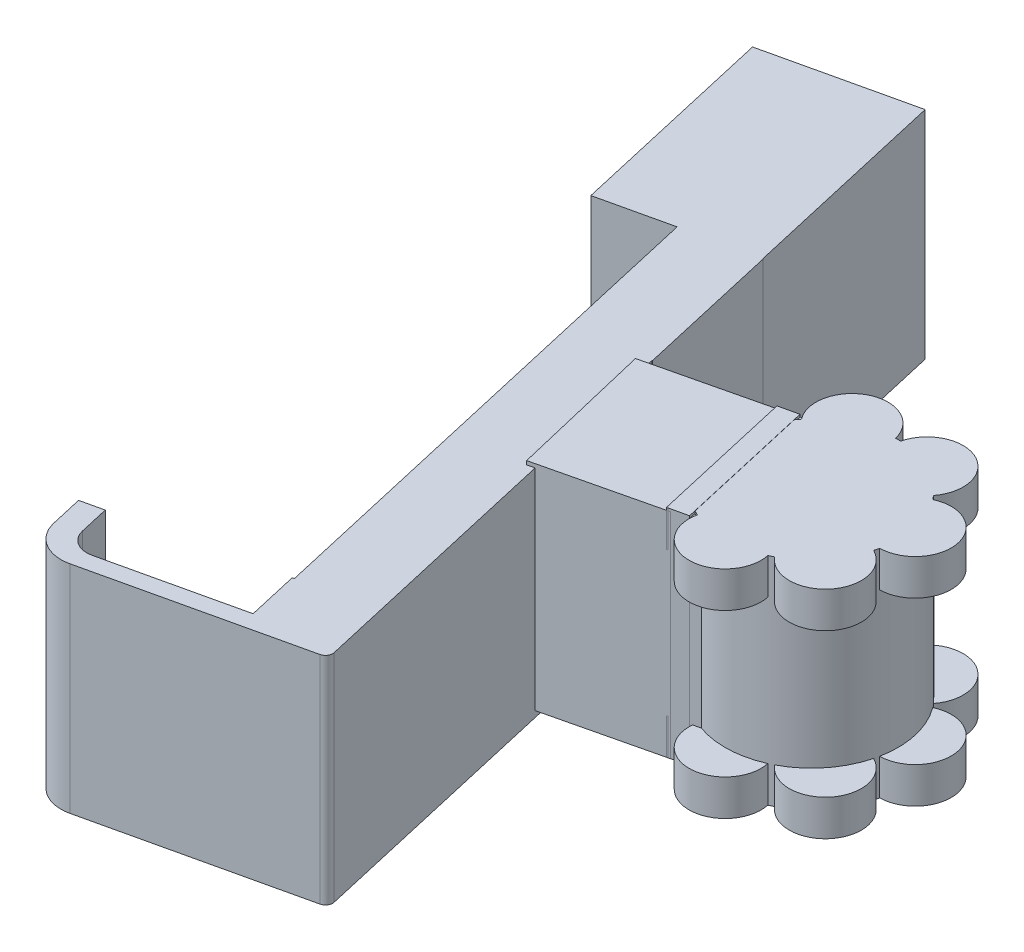
from build123d import *

# Parameters (mm, degrees)
SKETCH2_R                 = 30.48
BOSS_EXTRUDE1_DEPTH       = 76.2
SKETCH3_R                 = 12.7
BOSS_EXTRUDE2_DEPTH       = 12.7
BOSS_EXTRUDE6_START       = -12.7
SKETCH6_R                 = 12.7
BOSS_EXTRUDE6_DEPTH       = 12.7
SKETCH9_W                 = 51.728443154
SKETCH9_H                 = 76.282804762
BOSS_EXTRUDE7_DEPTH       = 48.26
BOSS_EXTRUDE8_DEPTH       = 76.2
BOSS_EXTRUDE8_DEPTH_BACK  = 203.2
SKETCH10_W                = 76.2
SKETCH10_H                = 25.4
FILLET1_R                 = 2.54
SKETCH11_W                = 24.315389243
SKETCH11_H                = 76.2
BOSS_EXTRUDE9_DEPTH       = 63.5
FILLET2_R                 = 12.7
SKETCH14_W                = 55.001607209
SKETCH14_H                = 80.712972361
CUT_EXTRUDE4_DEPTH        = 20.828
FILLET3_R                 = 7.62
SKETCH15_W                = 75.756816186
SKETCH15_H                = 76.2
BOSS_EXTRUDE10_DEPTH      = 25.4
SKETCH17_W                = 67.504794481
SKETCH17_H                = 69.753361914
CUT_EXTRUDE5_DEPTH        = 38.1
SKETCH18_R                = 2.54
CUT_EXTRUDE6_DEPTH        = 164.084
LPATTERN1_COUNT           = 2
LPATTERN1_PITCH           = 66.04
BOSS_EXTRUDE11_DEPTH      = 24.13
BOSS_EXTRUDE11_DEPTH_BACK = 24.13
SKETCH29_W                = 10.319134409
SKETCH29_H                = 15.64174453
CUT_EXTRUDE7_DEPTH        = 29.718
BOSS_EXTRUDE13_DEPTH      = 38.1
SKETCH32_W                = 39.507014282
SKETCH32_H                = 29.782993716
CUT_EXTRUDE8_DEPTH        = 17.78
SKETCH33_W                = 41.356450413
SKETCH33_H                = 75.385657755
CUT_EXTRUDE10_DEPTH       = 102.362
BODY_MOVE_COPY1_DEPTH     = 0.082804762
BODY_MOVE_COPY1_START     = 63.5
BODY_MOVE_COPY1_2_DEPTH   = 0.082804762
BODY_MOVE_COPY1_START_2   = 76.2
BODY_MOVE_COPY1_3_DEPTH   = 0.082804762
BODY_MOVE_COPY1_START_3   = 12.7
BODY_MOVE_COPY1_4_DEPTH   = 0.082804762
BODY_MOVE_COPY1_START_4   = 76.282804762
BODY_MOVE_COPY1_5_DEPTH   = 0.082804762
BOSS_EXTRUDE14_DEPTH      = 15.24
BOSS_EXTRUDE14_DEPTH_BACK = 41.402
SKETCH34_W                = 51.737242341
SKETCH34_H                = 75.399576407
SCALE1_SCALE              = 2
SCALE2_SCALE              = 1.5
SCALE3_SCALE              = 0.5
SCALE4_SCALE              = 2


# Read off the part's stored shape, not the designer's step: Body-Move/Copy1
with BuildPart() as part:
    # Sketch2 → Boss-Extrude1 (new body)
    with BuildSketch(Plane(origin=(0, 0, 0), x_dir=(1, 0, 0), z_dir=(0, 1, 0))):
        with Locations(Location((0, 0, 0), (0, 0, 90))):
            Circle(SKETCH2_R)
    extrude(amount=BOSS_EXTRUDE1_DEPTH)

    # Sketch3 → Boss-Extrude2 (add)
    with BuildSketch(Plane(origin=(0, 76.2, 0), x_dir=(1, 0, 0), z_dir=(0, 1, 0))):
        with Locations((0, -30.48)):
            Circle(SKETCH3_R)
        with Locations((-23.830223586, -19.003969161)):
            Circle(SKETCH3_R)
        with Locations((-29.715802763, 6.782438067)):
            Circle(SKETCH3_R)
        with Locations((-13.224776368, 27.461531094)):
            Circle(SKETCH3_R)
        with Locations((13.224776368, 27.461531094)):
            Circle(SKETCH3_R)
        with Locations((29.715802763, 6.782438067)):
            Circle(SKETCH3_R)
        with Locations((23.830223586, -19.003969161)):
            Circle(SKETCH3_R)
    extrude(amount=-BOSS_EXTRUDE2_DEPTH)

    # Sketch6 → Boss-Extrude6 (add)
    with BuildSketch(Plane(origin=(0, 0, 0), x_dir=(-1, 0, 0), z_dir=(0, -1, 0)).offset(BOSS_EXTRUDE6_START)):
        with Locations((0, -30.48)):
            Circle(SKETCH6_R)
        with Locations((-23.830223586, -19.003969161)):
            Circle(SKETCH6_R)
        with Locations((-29.715802763, 6.782438067)):
            Circle(SKETCH6_R)
        with Locations((-13.224776368, 27.461531094)):
            Circle(SKETCH6_R)
        with Locations((13.224776368, 27.461531094)):
            Circle(SKETCH6_R)
        with Locations((29.715802763, 6.782438067)):
            Circle(SKETCH6_R)
        with Locations((23.830223586, -19.003969161)):
            Circle(SKETCH6_R)
    extrude(amount=BOSS_EXTRUDE6_DEPTH)

    # Sketch9 → Boss-Extrude7 (add)
    with BuildSketch(Plane(origin=(-19.194675463, 0, 4.381059417), x_dir=(-0.22252093395629824, 0, -0.9749279121818273), z_dir=(0.9749279121818274, 0, -0.22252093395629827))):
        with Locations((0.024108474, 38.141402381)):
            Rectangle(SKETCH9_W, SKETCH9_H)
    extrude(amount=-BOSS_EXTRUDE7_DEPTH)

    # Sketch10 → Boss-Extrude8 (add, two sides: drawn at the far end of the back side and taken through both)
    with BuildSketch(Plane(origin=(-5.760695382, 0, -25.239255567), x_dir=(0, 1, 0), z_dir=(-0.22252093395629827, 0, -0.9749279121818274)).offset(-BOSS_EXTRUDE8_DEPTH_BACK)):
        with Locations((38.182804762, -80.648302307)):
            Rectangle(SKETCH10_W, SKETCH10_H)
    extrude(amount=BOSS_EXTRUDE8_DEPTH + BOSS_EXTRUDE8_DEPTH_BACK)

    # Fillet1
    fillet1_edges = [part.edges().sort_by_distance(p)[0] for p in [
        (-26.789138106, 38.182804762, 187.986015879),
    ]]
    fillet(fillet1_edges, radius=FILLET1_R)

    # Sketch11 → Boss-Extrude9 (add)
    with BuildSketch(Plane(origin=(-91.007865474, 0, 20.771951413), x_dir=(0.22252093395629827, 0, 0.9749279121818273), z_dir=(-0.9749279121818274, 0, 0.2225209339562983))):
        with Locations((165.153975328, 38.182804762)):
            Rectangle(SKETCH11_W, SKETCH11_H)
    extrude(amount=BOSS_EXTRUDE9_DEPTH)

    # Fillet2
    fillet2_edges = [part.edges().sort_by_distance(p)[0] for p in [
        (-113.460229499, 38.182804762, 207.768126907),
    ]]
    fillet(fillet2_edges, radius=FILLET2_R)

    # Sketch14 → Cut-Extrude4 (cut)
    with BuildSketch(Plane(origin=(33.479672102, 0, 146.684027623), x_dir=(-0.9749279121818273, 0, 0.22252093395629827), z_dir=(-0.2225209339562983, 0, -0.9749279121818274))):
        with Locations((121.488256365, 38.447479976)):
            Rectangle(SKETCH14_W, SKETCH14_H)
    extrude(amount=-CUT_EXTRUDE4_DEPTH, mode=Mode.SUBTRACT)

    # Fillet3
    fillet3_edges = [part.edges().sort_by_distance(p)[0] for p in [
        (-107.139255058, 38.182804762, 200.143010952),
    ]]
    fillet(fillet3_edges, radius=FILLET3_R)

    # Sketch15 → Boss-Extrude10 (add)
    with BuildSketch(Plane(origin=(-91.007865474, 0, 20.771951413), x_dir=(0.22252093395629827, 0, 0.9749279121818273), z_dir=(-0.9749279121818274, 0, 0.2225209339562983))):
        with Locations((-64.209921958, 38.182804762)):
            Rectangle(SKETCH15_W, SKETCH15_H)
    extrude(amount=BOSS_EXTRUDE10_DEPTH)

    # Sketch17 → Cut-Extrude5 (cut)
    with BuildSketch(Plane(origin=(-91.007865474, 0, 20.771951413), x_dir=(0.22252093395629827, 0, 0.9749279121818273), z_dir=(-0.9749279121818274, 0, 0.2225209339562983))):
        with Locations((-64.931434083, 36.64981302)):
            Rectangle(SKETCH17_W, SKETCH17_H)
    extrude(amount=CUT_EXTRUDE5_DEPTH, mode=Mode.SUBTRACT)

    # Sketch18 → Cut-Extrude6 (cut)
    with BuildSketch(Plane(origin=(-5.294109885, 0, -23.19501094), x_dir=(0.9749279121818273, 0, -0.2225209339562983), z_dir=(0.22252093395629832, 0, 0.9749279121818274))):
        with Locations((-93.317000231, 5.08)):
            Circle(SKETCH18_R)
    cut_extrude6 = extrude(amount=CUT_EXTRUDE6_DEPTH, mode=Mode.SUBTRACT)

    # LPattern1: Cut-Extrude6 ×2
    with Locations(*[(0, i * LPATTERN1_PITCH, 0) for i in range(1, LPATTERN1_COUNT)]):
        add(cut_extrude6, mode=Mode.SUBTRACT)

    # Sketch24 → Boss-Extrude11 (add, two sides: drawn at the far end of the back side and taken through both)
    with BuildSketch(Plane(origin=(0, 38.182804762, 0), x_dir=(1, 0, 0), z_dir=(0, 1, 0)).offset(-BOSS_EXTRUDE11_DEPTH_BACK)):
        Polygon((-91.836020311, -15.597668009), (-92.491872227, -11.144310268), (-96.669550778, -14.034535505), align=None)
        Polygon((-94.155460088, -25.04948652), (-89.321929621, -26.612619024), (-89.977781537, -22.159261283), align=None)
        Polygon((-92.898414743, -30.556962027), (-88.064884276, -32.120094532), (-88.720736192, -27.66673679), align=None)
        Polygon((-91.641369398, -36.064437535), (-86.807838931, -37.627570039), (-87.463690847, -33.174212298), align=None)
        Polygon((-90.384324053, -41.571913042), (-85.550793587, -43.135045547), (-86.206645502, -38.681687805), align=None)
        Polygon((-89.127278708, -47.07938855), (-84.293748242, -48.642521054), (-84.949600157, -44.189163313), align=None)
        Polygon((-87.870233363, -52.586864057), (-83.036702897, -54.149996561), (-83.692554812, -49.69663882), align=None)
        Polygon((-86.613188018, -58.094339565), (-81.779657552, -59.657472069), (-82.435509467, -55.204114328), align=None)
        Polygon((-85.356142674, -63.601815072), (-80.522612207, -65.164947576), (-81.178464122, -60.711589835), align=None)
        Polygon((-84.099097329, -69.109290579), (-79.265566862, -70.672423084), (-79.921418777, -66.219065342), align=None)
        Polygon((-82.842051984, -74.616766087), (-78.008521517, -76.179898591), (-78.664373432, -71.72654085), align=None)
        Polygon((-81.585006639, -80.124241594), (-76.751476172, -81.687374099), (-77.407328087, -77.234016357), align=None)
        Polygon((-80.327961294, -85.631717102), (-75.494430827, -87.194849606), (-76.150282742, -82.741491865), align=None)
        Polygon((-79.070915949, -91.139192609), (-74.237385482, -92.702325114), (-74.893237397, -88.248967372), align=None)
        Polygon((-77.813870604, -96.646668117), (-72.980340137, -98.209800621), (-73.636192052, -93.75644288), align=None)
        Polygon((-76.556825259, -102.154143624), (-71.723294792, -103.717276129), (-72.379146707, -99.263918387), align=None)
        Polygon((-75.299779914, -107.661619132), (-70.466249447, -109.224751636), (-71.122101363, -104.771393895), align=None)
        Polygon((-74.042734569, -113.169094639), (-69.209204102, -114.732227144), (-69.865056018, -110.278869402), align=None)
        Polygon((-72.785689224, -118.676570147), (-67.952158757, -120.239702651), (-68.608010673, -115.78634491), align=None)
        Polygon((-71.528643879, -124.184045654), (-66.695113412, -125.747178159), (-67.350965328, -121.293820417), align=None)
        Polygon((-70.271598534, -129.691521162), (-65.438068067, -131.254653666), (-66.093919983, -126.801295925), align=None)
        Polygon((-69.014553189, -135.198996669), (-64.181022722, -136.762129174), (-64.836874638, -132.308771432), align=None)
        Polygon((-67.757507844, -140.706472177), (-62.923977378, -142.269604681), (-63.579829293, -137.81624694), align=None)
        Polygon((-66.500462499, -146.213947684), (-61.666932033, -147.777080188), (-62.322783948, -143.323722447), align=None)
        Polygon((-65.243417154, -151.721423192), (-60.409886688, -153.284555696), (-61.065738603, -148.831197955), align=None)
        Polygon((-63.98637181, -157.228898699), (-59.152841343, -158.792031203), (-59.808693258, -154.338673462), align=None)
        Polygon((-62.729326465, -162.736374206), (-57.895795998, -164.299506711), (-58.551647913, -159.846148969), align=None)
        Polygon((-61.47228112, -168.243849714), (-56.638750653, -169.806982218), (-57.294602568, -165.353624477), align=None)
        Polygon((-60.215235775, -173.751325221), (-55.381705308, -175.314457726), (-56.037557223, -170.861099984), align=None)
    extrude(amount=BOSS_EXTRUDE11_DEPTH + BOSS_EXTRUDE11_DEPTH_BACK)

    # Sketch29 → Cut-Extrude7 (cut)
    with BuildSketch(Plane(origin=(-22.716790549, 0, -99.528762475), x_dir=(-0.9749279121818273, 0, 0.22252093395629827), z_dir=(-0.2225209339562983, 0, -0.9749279121818274))):
        with Locations((100.830084752, 61.756724735)):
            Rectangle(SKETCH29_W, SKETCH29_H)
    extrude(amount=-CUT_EXTRUDE7_DEPTH, mode=Mode.SUBTRACT)

    # Sketch30 → Boss-Extrude13 (add)
    with BuildSketch(Plane(origin=(0, 0.082804762, 0), x_dir=(-1, 0, 0), z_dir=(0, -1, 0))):
        Polygon((101.002769309, 70.397611685), (91.080663922, 25.61678931), (114.836558826, 20.353185823), (124.758664212, 65.134008198), align=None)
    extrude(amount=BOSS_EXTRUDE13_DEPTH)

    # Sketch32 → Cut-Extrude8 (cut)
    with BuildSketch(Plane(origin=(-105.164030087, 0, 23.301237763), x_dir=(0.21632398921904566, 0, 0.9763216333198595), z_dir=(-0.9763216333198595, 0, 0.21632398921904566))):
        with Locations((-67.649390267, -18.065303468)):
            Rectangle(SKETCH32_W, SKETCH32_H)
    extrude(amount=-CUT_EXTRUDE8_DEPTH, mode=Mode.SUBTRACT)

    # Sketch33 → Cut-Extrude10 (cut)
    with BuildSketch(Plane(origin=(0, 0, 0), x_dir=(0.9749279121818273, 0, -0.2225209339562983), z_dir=(0, 1, 0))):
        with Locations((-47.153059458, 2.897999225)):
            Rectangle(SKETCH33_W, SKETCH33_H)
    extrude(amount=CUT_EXTRUDE10_DEPTH, mode=Mode.SUBTRACT)


with BuildPart() as cut_extrude10_piece_1:
    # of the separate pieces the step leaves, piece 1, a body of its own (cut_extrude10_pieces)
    add(part.part.solids().sort_by_distance((-99.710304368, 76.282804762, 198.447401435))[0])



with BuildPart() as cut_extrude10_piece_2:
    # of the separate pieces the step leaves, piece 2, a body of its own (cut_extrude10_pieces)
    add(part.part.solids().sort_by_distance((-31.571750264, 76.282804762, -19.348050723))[0])

    # Body-Move/Copy1 outline → Body-Move/Copy1 (cut)
    with BuildSketch(Plane(origin=(0, 0, 0), x_dir=(1, 0, 0), z_dir=(0, 1, 0))):
        with BuildLine():
            Line((-31.571750264, 19.348050723), (-20.05079147, -31.12856783))
            ThreePointArc((-20.05079147, -31.12856783), (-19.822560569, -31.055053641), (-19.595758246, -30.977243704))
            Line((-19.595758246, -30.977243704), (-13.444709362, -29.573306935))
            Line((-13.444709362, -29.573306935), (-14.01705202, -27.065709905))
            ThreePointArc((-14.01705202, -27.065709905), (-13.224776368, -27.461531094), (-12.421335112, -27.834166667))
            ThreePointArc((-12.421335112, -27.834166667), (0, -43.18), (12.421335112, -27.834166667))
            ThreePointArc((12.421335112, -27.834166667), (13.224776368, -27.461531094), (14.01705202, -27.065709905))
            ThreePointArc((14.01705202, -27.065709905), (33.759483413, -26.922289644), (29.506203556, -7.642928215))
            ThreePointArc((29.506203556, -7.642928215), (29.715802763, -6.782438067), (29.900313086, -5.916221545))
            ThreePointArc((29.900313086, -5.916221545), (42.097387248, 9.608453929), (24.372298905, 18.30359107))
            ThreePointArc((24.372298905, 18.30359107), (23.830223585, 19.00396916), (23.268028543, 19.688302307))
            ThreePointArc((23.268028543, 19.688302307), (18.735099856, 38.903835716), (0.885556075, 30.467132954))
            ThreePointArc((0.885556075, 30.467132954), (0, 30.479999999), (-0.885556075, 30.467132954))
            ThreePointArc((-0.885556075, 30.467132954), (-18.735099856, 38.903835716), (-23.268028543, 19.688302307))
            ThreePointArc((-23.268028543, 19.688302307), (-23.830223585, 19.00396916), (-24.372298905, 18.30359107))
            Line((-24.372298905, 18.30359107), (-24.955370844, 20.858196149))
            Line((-24.955370844, 20.858196149), (-31.571750264, 19.348050723))
        make_face()
    extrude(amount=BODY_MOVE_COPY1_DEPTH, mode=Mode.SUBTRACT)

    # Body-Move_Copy1 2 outline → Body-Move_Copy1 2 (cut)
    with BuildSketch(Plane(origin=(0, 0, 0), x_dir=(1, 0, 0), z_dir=(0, 1, 0)).offset(BODY_MOVE_COPY1_START)):
        with BuildLine():
            Line((-19.595758246, -30.977243704), (-20.061088781, -31.083452362))
            Line((-20.061088781, -31.083452362), (-20.05079147, -31.12856783))
            ThreePointArc((-20.05079147, -31.12856783), (-19.822560569, -31.055053641), (-19.595758246, -30.977243704))
        make_face()
        with BuildLine():
            ThreePointArc((12.421335112, -27.834166667), (0, -30.48), (-12.421335112, -27.834166667))
            ThreePointArc((-12.421335112, -27.834166667), (0, -43.18), (12.421335112, -27.834166667))
        make_face()
        with BuildLine():
            ThreePointArc((-0.885556075, 30.467132954), (-18.735099856, 38.903835716), (-23.268028543, 19.688302307))
            ThreePointArc((-23.268028543, 19.688302307), (-13.224776369, 27.461531093), (-0.885556075, 30.467132954))
        make_face()
        with BuildLine():
            ThreePointArc((29.506203556, -7.642928215), (23.830223585, -19.003969161), (14.01705202, -27.065709905))
            ThreePointArc((14.01705202, -27.065709905), (33.759483413, -26.922289644), (29.506203556, -7.642928215))
        make_face()
        with BuildLine():
            ThreePointArc((23.268028543, 19.688302307), (18.735099856, 38.903835716), (0.885556075, 30.467132954))
            ThreePointArc((0.885556075, 30.467132954), (13.224776369, 27.461531093), (23.268028543, 19.688302307))
        make_face()
        with BuildLine():
            ThreePointArc((24.372298905, 18.30359107), (29.715802763, 6.782438067), (29.900313086, -5.916221545))
            ThreePointArc((29.900313086, -5.916221545), (42.097387248, 9.608453929), (24.372298905, 18.30359107))
        make_face()
    extrude(amount=BODY_MOVE_COPY1_2_DEPTH, mode=Mode.SUBTRACT)

    # Body-Move_Copy1 3 outline → Body-Move_Copy1 3 (add)
    with BuildSketch(Plane(origin=(0, 0, 0), x_dir=(1, 0, 0), z_dir=(0, 1, 0)).offset(BODY_MOVE_COPY1_START_2)):
        with BuildLine():
            Line((-19.595758246, -30.977243704), (-20.061088781, -31.083452362))
            Line((-20.061088781, -31.083452362), (-20.05079147, -31.12856783))
            ThreePointArc((-20.05079147, -31.12856783), (-19.822560569, -31.055053641), (-19.595758246, -30.977243704))
        make_face()
        with BuildLine():
            Line((-24.372298905, 18.30359107), (-14.01705202, -27.065709905))
            ThreePointArc((-14.01705202, -27.065709905), (-13.224776368, -27.461531094), (-12.421335112, -27.834166667))
            ThreePointArc((-12.421335112, -27.834166667), (0, -43.18), (12.421335112, -27.834166667))
            ThreePointArc((12.421335112, -27.834166667), (13.224776368, -27.461531094), (14.01705202, -27.065709905))
            ThreePointArc((14.01705202, -27.065709905), (33.759483413, -26.922289644), (29.506203556, -7.642928215))
            ThreePointArc((29.506203556, -7.642928215), (29.715802763, -6.782438067), (29.900313086, -5.916221545))
            ThreePointArc((29.900313086, -5.916221545), (42.097387248, 9.608453929), (24.372298905, 18.30359107))
            ThreePointArc((24.372298905, 18.30359107), (23.830223585, 19.00396916), (23.268028543, 19.688302307))
            ThreePointArc((23.268028543, 19.688302307), (18.735099856, 38.903835716), (0.885556075, 30.467132954))
            ThreePointArc((0.885556075, 30.467132954), (0, 30.479999999), (-0.885556075, 30.467132954))
            ThreePointArc((-0.885556075, 30.467132954), (-18.735099856, 38.903835716), (-23.268028543, 19.688302307))
            ThreePointArc((-23.268028543, 19.688302307), (-23.830223585, 19.00396916), (-24.372298905, 18.30359107))
        make_face()
    extrude(amount=BODY_MOVE_COPY1_3_DEPTH)

    # Body-Move_Copy1 4 outline → Body-Move_Copy1 4 (add)
    with BuildSketch(Plane(origin=(0, 0, 0), x_dir=(1, 0, 0), z_dir=(0, 1, 0)).offset(BODY_MOVE_COPY1_START_3)):
        with BuildLine():
            Line((-19.595758246, -30.977243704), (-20.061088781, -31.083452362))
            Line((-20.061088781, -31.083452362), (-20.05079147, -31.12856783))
            ThreePointArc((-20.05079147, -31.12856783), (-19.822560569, -31.055053641), (-19.595758246, -30.977243704))
        make_face()
        with BuildLine():
            ThreePointArc((12.421335112, -27.834166667), (0, -30.48), (-12.421335112, -27.834166667))
            ThreePointArc((-12.421335112, -27.834166667), (0, -43.18), (12.421335112, -27.834166667))
        make_face()
        with BuildLine():
            ThreePointArc((-0.885556075, 30.467132954), (-18.735099856, 38.903835716), (-23.268028543, 19.688302307))
            ThreePointArc((-23.268028543, 19.688302307), (-13.224776369, 27.461531093), (-0.885556075, 30.467132954))
        make_face()
        with BuildLine():
            ThreePointArc((29.506203556, -7.642928215), (23.830223585, -19.003969161), (14.01705202, -27.065709905))
            ThreePointArc((14.01705202, -27.065709905), (33.759483413, -26.922289644), (29.506203556, -7.642928215))
        make_face()
        with BuildLine():
            ThreePointArc((23.268028543, 19.688302307), (18.735099856, 38.903835716), (0.885556075, 30.467132954))
            ThreePointArc((0.885556075, 30.467132954), (13.224776369, 27.461531093), (23.268028543, 19.688302307))
        make_face()
        with BuildLine():
            ThreePointArc((24.372298905, 18.30359107), (29.715802763, 6.782438067), (29.900313086, -5.916221545))
            ThreePointArc((29.900313086, -5.916221545), (42.097387248, 9.608453929), (24.372298905, 18.30359107))
        make_face()
    extrude(amount=BODY_MOVE_COPY1_4_DEPTH)

    # Body-Move_Copy1 5 outline → Body-Move_Copy1 5 (add)
    with BuildSketch(Plane(origin=(0, 0, 0), x_dir=(1, 0, 0), z_dir=(0, 1, 0)).offset(BODY_MOVE_COPY1_START_4)):
        Polygon((-31.571750264, 19.348050723), (-20.061088781, -31.083452362), (-13.444709362, -29.573306935), (-24.955370844, 20.858196149), align=None)
    extrude(amount=BODY_MOVE_COPY1_5_DEPTH)


with BuildPart() as cut_extrude10_piece_2_1:
    # Body-Move/Copy2: moved
    add(cut_extrude10_piece_2.part.moved(Location((39.494595911, -1172.515944541, 3.498489367))))


with BuildPart() as cut_extrude10_piece_2_2:
    # Body-Move/Copy3: moved
    add(cut_extrude10_piece_2_1.part.moved(Location((0, 1162.753885034, 34.335121026))))


with BuildPart() as cut_extrude10_piece_2_3:
    # Body-Move/Copy4: moved
    add(cut_extrude10_piece_2_2.part.moved(Location((-30.360721006, 11.870434586, 15.863414005))))


with BuildPart() as cut_extrude10_piece_1_1:
    add(cut_extrude10_piece_1.part)

    add(cut_extrude10_piece_2_3.part)  # Boss-Extrude14 merges Cut-Extrude10 piece 2
    # Sketch34 → Boss-Extrude14 (add, two sides: drawn at the far end of the back side and taken through both)
    with BuildSketch(Plane(origin=(-28.971297512, 0, 6.894346704), x_dir=(-0.23150672084325916, 0, -0.9728333044280513), z_dir=(0.9728333044280513, 0, -0.23150672084325916)).offset(-BOSS_EXTRUDE14_DEPTH_BACK)):
        with Locations((-54.089927788, 39.890968044)):
            Rectangle(SKETCH34_W, SKETCH34_H)
    extrude(amount=BOSS_EXTRUDE14_DEPTH + BOSS_EXTRUDE14_DEPTH_BACK)


with BuildPart() as cut_extrude10_piece_1_2:
    # Scale1: scaled about (-47.854165046, 37.920466278, 56.91247549)
    add(cut_extrude10_piece_1_1.part.scale(SCALE1_SCALE).moved(Location((47.854165046, -37.920466278, -56.91247549))))


with BuildPart() as cut_extrude10_piece_1_3:
    # Scale2: scaled about (-47.854165046, 37.920466278, 56.91247549)
    add(cut_extrude10_piece_1_2.part.scale(SCALE2_SCALE).moved(Location((23.927082523, -18.960233139, -28.456237745))))


with BuildPart() as cut_extrude10_piece_1_4:
    # Scale3: scaled about (-47.854165047, 37.920466278, 56.912475489)
    add(cut_extrude10_piece_1_3.part.scale(SCALE3_SCALE).moved(Location((-23.927082524, 18.960233139, 28.456237745))))


with BuildPart() as cut_extrude10_piece_1_5:
    # Scale4: scaled about (-47.854165047, 37.920466278, 56.912475489)
    add(cut_extrude10_piece_1_4.part.scale(SCALE4_SCALE).moved(Location((47.854165047, -37.920466278, -56.912475489))))


solid = cut_extrude10_piece_1_5.part
